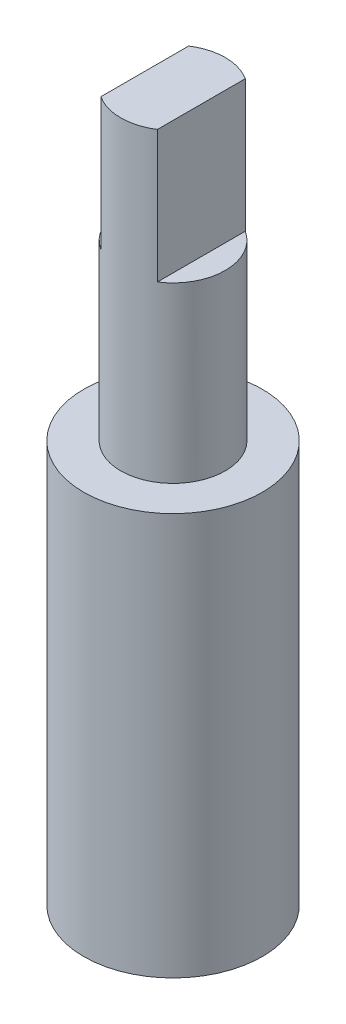
from build123d import *

# Parameters (mm, degrees)
SKETCH1_R           = 3.075
BOSS_EXTRUDE1_DEPTH = 13.85
SKETCH2_R           = 1.8
BOSS_EXTRUDE2_DEPTH = 5.98
BOSS_EXTRUDE3_DEPTH = 4.55
SKETCH4_R           = 2.15
CUT_EXTRUDE1_DEPTH  = 1.95


with BuildPart() as part:
    # Sketch1 → Boss-Extrude1 (new body)
    with BuildSketch(Plane(origin=(0, 0, 0), x_dir=(1, 0, 0), z_dir=(0, 1, 0))):
        Circle(SKETCH1_R)
    extrude(amount=BOSS_EXTRUDE1_DEPTH)

    # Sketch2 → Boss-Extrude2 (add)
    with BuildSketch(Plane(origin=(0, 13.85, 0), x_dir=(1, 0, 0), z_dir=(0, 1, 0))):
        Circle(SKETCH2_R)
    extrude(amount=BOSS_EXTRUDE2_DEPTH)

    # Sketch3 → Boss-Extrude3 (add)
    with BuildSketch(Plane(origin=(0, 19.83, 0), x_dir=(1, 0, 0), z_dir=(0, 1, 0))):
        with BuildLine():
            Line((-0.975, 1.513068075), (-0.975, -1.513068075))
            ThreePointArc((-0.975, -1.513068075), (0, -1.8), (0.975, -1.513068075))
            Line((0.975, -1.513068075), (0.975, 1.513068075))
            ThreePointArc((0.975, 1.513068075), (0, 1.8), (-0.975, 1.513068075))
        make_face()
    extrude(amount=BOSS_EXTRUDE3_DEPTH)

    # Sketch4 → Cut-Extrude1 (cut)
    with BuildSketch(Plane.XZ):
        Circle(SKETCH4_R)
    extrude(amount=-CUT_EXTRUDE1_DEPTH, mode=Mode.SUBTRACT)


solid = part.part
